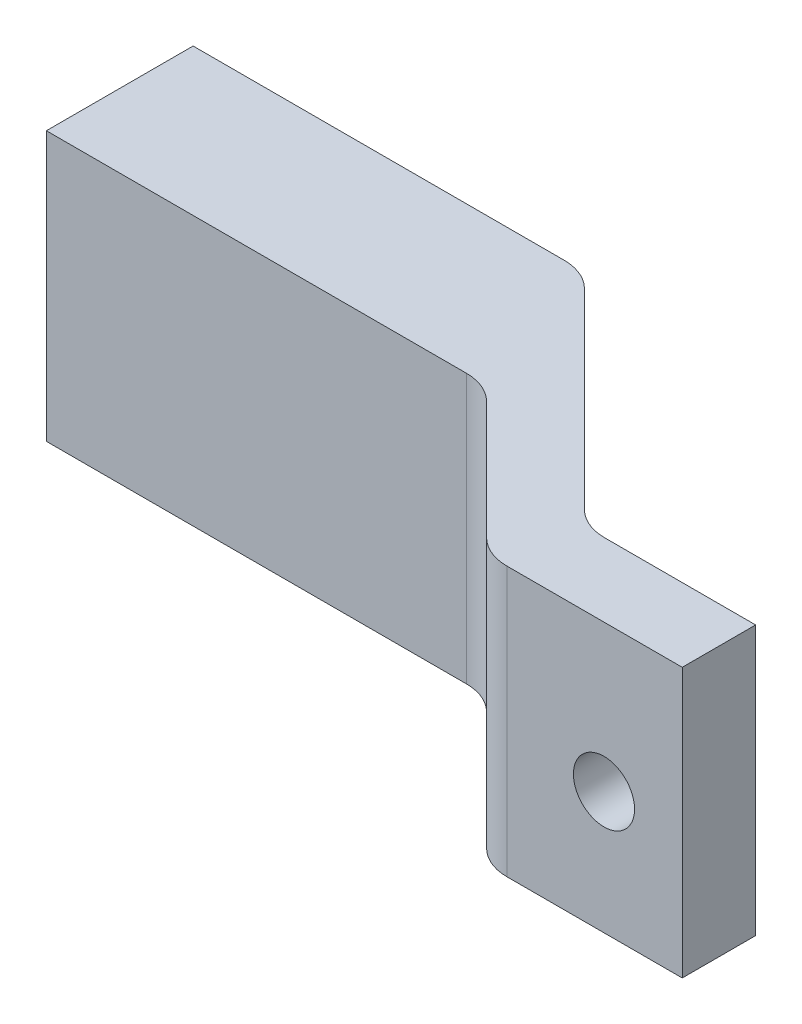
from build123d import *

# Parameters (mm, degrees)
CROQUIS1_W              = 18
CROQUIS1_H              = 11
SALIENTE_EXTRUIR1_DEPTH = 6
CROQUIS3_W              = 12
CROQUIS3_H              = 11.002490455
SALIENTE_EXTRUIR2_DEPTH = 8
CROQUIS4_W              = 3
CROQUIS4_H              = 11.002490455
SALIENTE_EXTRUIR3_DEPTH = 6
CROQUIS5_R              = 1.25
CORTAR_EXTRUIR1_DEPTH   = 10
CROQUIS6_R              = 1.25
CORTAR_EXTRUIR2_DEPTH   = 10
CHAFL_N1_SIZE           = 10
CHAFL_N2_SIZE           = 6
REDONDEO1_R             = 2


with BuildPart() as part:
    # Croquis1 → Saliente-Extruir1 (new body)
    with BuildSketch(Plane.XY):
        with Locations((9, -5.5)):
            Rectangle(CROQUIS1_W, CROQUIS1_H)
    extrude(amount=SALIENTE_EXTRUIR1_DEPTH)

    # Croquis3 → Saliente-Extruir2 (add)
    with BuildSketch(Plane(origin=(18, 0, 0), x_dir=(0, 0, -1), z_dir=(1, 0, 0))):
        with Locations((-6, -5.501245228)):
            Rectangle(CROQUIS3_W, CROQUIS3_H)
    extrude(amount=SALIENTE_EXTRUIR2_DEPTH)

    # Croquis4 → Saliente-Extruir3 (add)
    with BuildSketch(Plane(origin=(26, 0, 0), x_dir=(0, 0, -1), z_dir=(1, 0, 0))):
        with Locations((-10.5, -5.501245228)):
            Rectangle(CROQUIS4_W, CROQUIS4_H)
    extrude(amount=SALIENTE_EXTRUIR3_DEPTH)

    # Croquis5 → Cortar-Extruir1 (cut)
    with BuildSketch(Plane.ZY):
        with Locations(Location((2.2, -5.7, 0), (0, 0, 270))):
            Circle(CROQUIS5_R)
    extrude(amount=-CORTAR_EXTRUIR1_DEPTH, mode=Mode.SUBTRACT)

    # Croquis6 → Cortar-Extruir2 (cut)
    with BuildSketch(Plane.XY.offset(12)):
        with Locations((28.8, -6.002490455)):
            Circle(CROQUIS6_R)
    extrude(amount=-CORTAR_EXTRUIR2_DEPTH, mode=Mode.SUBTRACT)

    # Chaflán1
    # the kernel refuses this chamfer: 10 mm, written as the material it takes off along each edge
    with BuildSketch(Plane(origin=(26, -36.719320335, 0), x_dir=(0, 0, 1), z_dir=(0, 1, 0))) as chafl_n1_piece_1_section:
        Polygon((CHAFL_N1_SIZE, 0), (0, -CHAFL_N1_SIZE), (0, 0), align=None)
    chafl_n1_piece_1 = extrude(amount=62.436150214, mode=Mode.PRIVATE)
    chafl_n1_piece_1 = split(chafl_n1_piece_1, bisect_by=Plane(origin=(26, -36.719320335, 9), z_dir=(0, 0, -1)), keep=Keep.TOP, mode=Mode.PRIVATE)
    add(chafl_n1_piece_1, mode=Mode.SUBTRACT)

    # Chaflán2
    chafl_n2_edges = [part.edges().sort_by_distance(p)[0] for p in [
        (18, -5.501245227, 12),
    ]]
    chamfer(chafl_n2_edges, length=CHAFL_N2_SIZE)

    # Redondeo1
    redondeo1_edges = [part.edges().sort_by_distance(p)[0] for p in [
        (18, -5.5, 6),
        (16, -5.5, 0),
        (25, -5.501245227, 9),
        (24, -5.501245227, 12),
    ]]
    fillet(redondeo1_edges, radius=REDONDEO1_R)


solid = part.part
